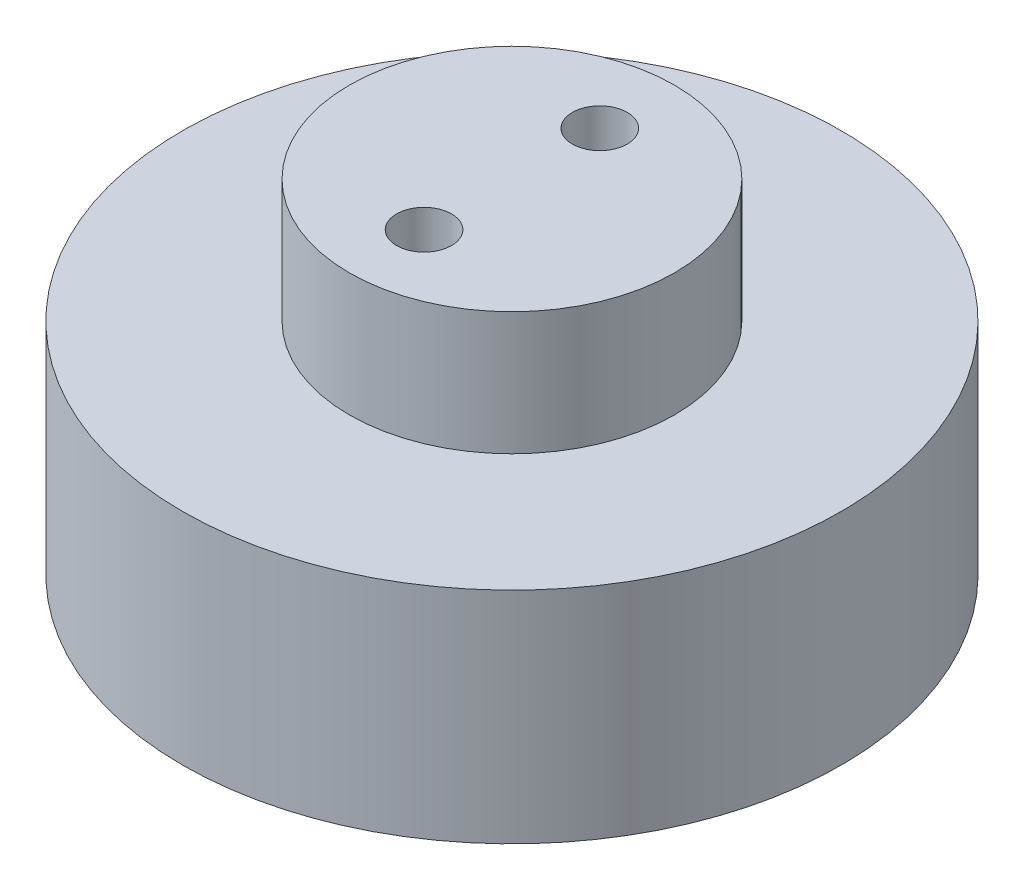
from build123d import *

# Parameters (mm, degrees)
SKETCH1_R           = 19.05
BOSS_EXTRUDE1_DEPTH = 12.7
SKETCH2_R           = 9.398
BOSS_EXTRUDE2_DEPTH = 7.112
CUT_EXTRUDE3_DEPTH  = 3.175
SKETCH6_R           = 1.5875
CUT_EXTRUDE4_DEPTH  = 7.62
SKETCH7_R           = 2.921
CUT_EXTRUDE5_DEPTH  = 17.272
SKETCH8_R           = 1.5875
CUT_EXTRUDE6_DEPTH  = 33.001984063


with BuildPart() as part:
    # Sketch1 → Boss-Extrude1 (new body)
    with BuildSketch(Plane(origin=(0, 0, 0), x_dir=(1, 0, 0), z_dir=(0, 1, 0))):
        Circle(SKETCH1_R)
    extrude(amount=BOSS_EXTRUDE1_DEPTH)

    # Sketch2 → Boss-Extrude2 (add)
    with BuildSketch(Plane(origin=(0, 12.7, 0), x_dir=(1, 0, 0), z_dir=(0, 1, 0))):
        Circle(SKETCH2_R)
    extrude(amount=BOSS_EXTRUDE2_DEPTH)

    # Sketch5 → Cut-Extrude3 (cut)
    with BuildSketch(Plane.XZ):
        Polygon((-5.393973528, 0), (-7.776986764, 4.1275), (-12.543013236, 4.1275), (-14.926026472, 0), (-12.543013236, -4.1275), (-7.776986764, -4.1275), align=None)
        Polygon((14.926026472, 0), (12.543013236, 4.1275), (7.776986764, 4.1275), (5.393973528, 0), (7.776986764, -4.1275), (12.543013236, -4.1275), align=None)
    extrude(amount=-CUT_EXTRUDE3_DEPTH, mode=Mode.SUBTRACT)

    # Sketch6 → Cut-Extrude4 (cut)
    with BuildSketch(Plane.XZ):
        with Locations((-10.16, 0)):
            Circle(SKETCH6_R)
        with Locations((10.16, 0)):
            Circle(SKETCH6_R)
    extrude(amount=-CUT_EXTRUDE4_DEPTH, mode=Mode.SUBTRACT)

    # Sketch7 → Cut-Extrude5 (cut)
    with BuildSketch(Plane.XZ):
        with Locations((0, 5.08)):
            Circle(SKETCH7_R)
        with Locations((0, -5.08)):
            Circle(SKETCH7_R)
    extrude(amount=-CUT_EXTRUDE5_DEPTH, mode=Mode.SUBTRACT)

    # Sketch8 → Cut-Extrude6 (cut, through all)
    with BuildSketch(Plane.XZ.offset(-17.272)):
        with Locations((0, 5.08)):
            Circle(SKETCH8_R)
        with Locations((0, -5.08)):
            Circle(SKETCH8_R)
    extrude(amount=-CUT_EXTRUDE6_DEPTH, mode=Mode.SUBTRACT)


solid = part.part
